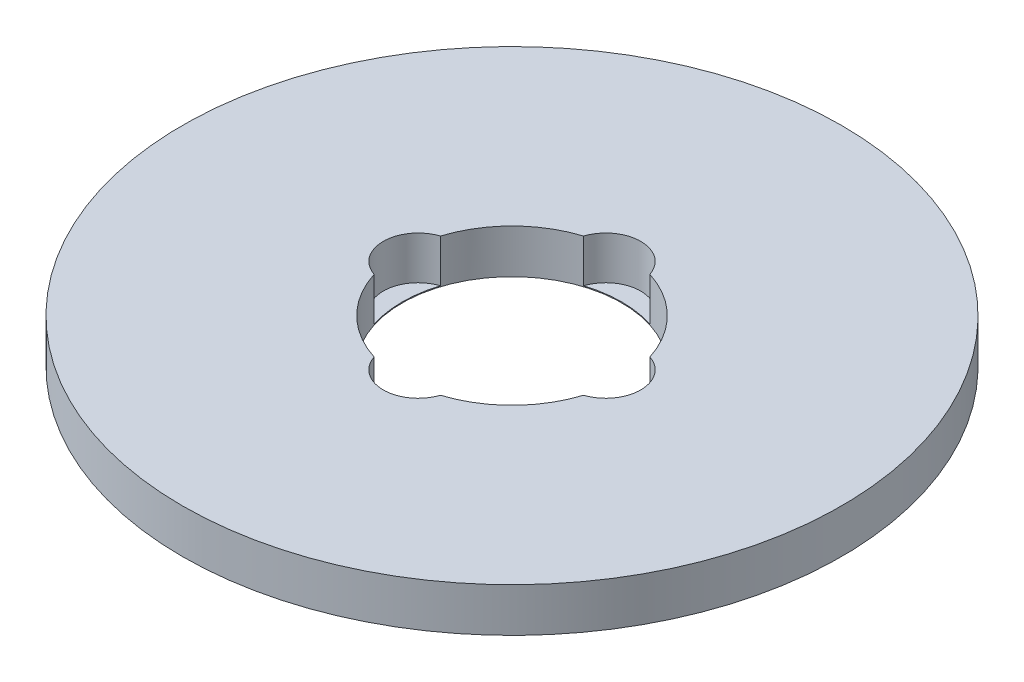
from build123d import *

# Parameters (mm, degrees)
SKETCH1_R           = 30
BOSS_EXTRUDE1_DEPTH = 4
SKETCH2_R           = 10
CUT_EXTRUDE1_DEPTH  = 43.614551505
SKETCH3_R           = 3.176683692
CUT_EXTRUDE2_DEPTH  = 3.92223649
CIRPATTERN1_COUNT   = 4


with BuildPart() as part:
    # Sketch1 → Boss-Extrude1 (new body)
    with BuildSketch(Plane(origin=(0, 0, 0), x_dir=(1, 0, 0), z_dir=(0, 1, 0))):
        Circle(SKETCH1_R)
    extrude(amount=BOSS_EXTRUDE1_DEPTH)

    # Sketch2 → Cut-Extrude1 (cut, through all)
    with BuildSketch(Plane(origin=(0, 0, 0), x_dir=(1, 0, 0), z_dir=(0, 1, 0))):
        Circle(SKETCH2_R)
    extrude(amount=CUT_EXTRUDE1_DEPTH, mode=Mode.SUBTRACT)

    # Sketch3 → Cut-Extrude2 (cut)
    with BuildSketch(Plane(origin=(0, 4, 0), x_dir=(1, 0, 0), z_dir=(0, 1, 0))):
        with Locations((-8.54136093, 0)):
            Circle(SKETCH3_R)
    cut_extrude2 = extrude(amount=-CUT_EXTRUDE2_DEPTH, mode=Mode.SUBTRACT)

    # CirPattern1: Cut-Extrude2 ×4 about axis
    cirpattern1_axis = Axis((0, 0, 0), (0, 1, 0))
    for i in range(1, CIRPATTERN1_COUNT):
        add(cut_extrude2.rotate(cirpattern1_axis, i * 360 / CIRPATTERN1_COUNT), mode=Mode.SUBTRACT)


solid = part.part
